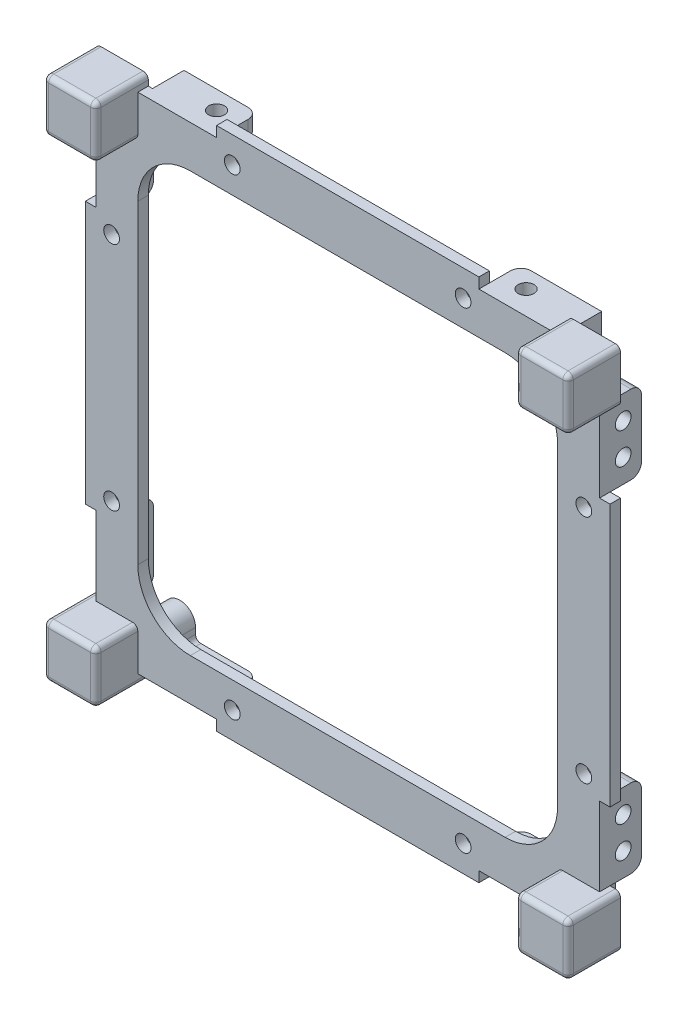
from build123d import *

# Parameters (mm, degrees)
SKETCH1_R               = 1.5
BOSS_EXTRUDE1_DEPTH     = 2
BOSS_EXTRUDE3_DEPTH     = 8
FILLET2_R               = 1
SKETCH6_R               = 1.5
SKETCH6_W               = 3
SKETCH6_H               = 15
BOSS_EXTRUDE5_DEPTH     = 6
FILLET3_R               = 2
CUT_EXTRUDE1_DEPTH      = 72.414284285
CUT_EXTRUDE1_DEPTH_BACK = 72.414284285
SKETCH7_R               = 1.5
CUT_EXTRUDE2_DEPTH      = 72.414284285
CUT_EXTRUDE2_DEPTH_BACK = 72.414284285
SKETCH8_R               = 1.5


with BuildPart() as part:
    # Sketch1 → Boss-Extrude1 (new body)
    with BuildSketch(Plane.XY):
        with BuildLine():
            Line((-50, 40), (-48, 40))
            Line((-48, 40), (-48, 25))
            Line((-48, 25), (-50, 25))
            Line((-50, 25), (-50, -25))
            Line((-50, -25), (-48, -25))
            Line((-48, -25), (-48, -40))
            Line((-48, -40), (-50, -40))
            Line((-50, -40), (-50, -49))
            ThreePointArc((-50, -49), (-49.707106781, -49.707106781), (-49, -50))
            Line((-49, -50), (-40, -50))
            Line((-40, -50), (-40, -48))
            Line((-40, -48), (-25, -48))
            Line((-25, -48), (-25, -50))
            Line((-25, -50), (25, -50))
            Line((25, -50), (25, -48))
            Line((25, -48), (40, -48))
            Line((40, -48), (40, -50))
            Line((40, -50), (49, -50))
            ThreePointArc((49, -50), (49.707106781, -49.707106781), (50, -49))
            Line((50, -49), (50, -40))
            Line((50, -40), (48, -40))
            Line((48, -40), (48, -25))
            Line((48, -25), (50, -25))
            Line((50, -25), (50, 25))
            Line((50, 25), (48, 25))
            Line((48, 25), (48, 40))
            Line((48, 40), (50, 40))
            Line((50, 40), (50, 49))
            ThreePointArc((50, 49), (49.707106781, 49.707106781), (49, 50))
            Line((49, 50), (40, 50))
            Line((40, 50), (40, 48))
            Line((40, 48), (25, 48))
            Line((25, 48), (25, 50))
            Line((25, 50), (-25, 50))
            Line((-25, 50), (-25, 48))
            Line((-25, 48), (-40, 48))
            Line((-40, 48), (-40, 50))
            Line((-40, 50), (-49, 50))
            ThreePointArc((-49, 50), (-49.707106781, 49.707106781), (-50, 49))
            Line((-50, 49), (-50, 40))
        make_face()
        with Locations((-45, 22)):
            Circle(SKETCH1_R, mode=Mode.SUBTRACT)
        with Locations((-22, 45)):
            Circle(SKETCH1_R, mode=Mode.SUBTRACT)
        with Locations((22, 45)):
            Circle(SKETCH1_R, mode=Mode.SUBTRACT)
        with Locations((45, 22)):
            Circle(SKETCH1_R, mode=Mode.SUBTRACT)
        with Locations((45, -22)):
            Circle(SKETCH1_R, mode=Mode.SUBTRACT)
        with Locations((22, -45)):
            Circle(SKETCH1_R, mode=Mode.SUBTRACT)
        with Locations((-22, -45)):
            Circle(SKETCH1_R, mode=Mode.SUBTRACT)
        with Locations((-45, -22)):
            Circle(SKETCH1_R, mode=Mode.SUBTRACT)
        with BuildLine():
            Line((-30, -40), (30, -40))
            ThreePointArc((30, -40), (37.071067812, -37.071067812), (40, -30))
            Line((40, -30), (40, 30))
            ThreePointArc((40, 30), (37.071067812, 37.071067812), (30, 40))
            Line((30, 40), (-30, 40))
            ThreePointArc((-30, 40), (-37.071067812, 37.071067812), (-40, 30))
            Line((-40, 30), (-40, -30))
            ThreePointArc((-40, -30), (-37.071067812, -37.071067812), (-30, -40))
        make_face(mode=Mode.SUBTRACT)
    extrude(amount=BOSS_EXTRUDE1_DEPTH)

    # Sketch2 → Boss-Extrude3 (add)
    with BuildSketch(Plane.XY.offset(2)):
        with BuildLine():
            Line((-49, 50), (-40, 50))
            Line((-40, 50), (-40, 40))
            Line((-40, 40), (-50, 40))
            Line((-50, 40), (-50, 49))
            ThreePointArc((-50, 49), (-49.707106781, 49.707106781), (-49, 50))
        make_face()
        with BuildLine():
            Line((40, 50), (40, 40))
            Line((40, 40), (50, 40))
            Line((50, 40), (50, 49))
            ThreePointArc((50, 49), (49.707106781, 49.707106781), (49, 50))
            Line((49, 50), (40, 50))
        make_face()
        with BuildLine():
            Line((49, -50), (40, -50))
            Line((40, -50), (40, -40))
            Line((40, -40), (50, -40))
            Line((50, -40), (50, -49))
            ThreePointArc((50, -49), (49.707106781, -49.707106781), (49, -50))
        make_face()
        with BuildLine():
            Line((-40, -50), (-40, -40))
            Line((-40, -40), (-50, -40))
            Line((-50, -40), (-50, -49))
            ThreePointArc((-50, -49), (-49.707106781, -49.707106781), (-49, -50))
            Line((-49, -50), (-40, -50))
        make_face()
    extrude(amount=BOSS_EXTRUDE3_DEPTH)

    # Fillet2
    fillet2_edges = [part.edges().sort_by_distance(p)[0] for p in [
        (-44.5, 50, 10),
        (-49.707106781, 49.707106781, 10),
        (-50, 44.5, 10),
        (-40, 50, 5),
        (-45, 40, 10),
        (-40, 45, 10),
        (-40, 40, 6),
        (-50, 40, 5),
        (-40, -50, 5),
        (-40, -45, 10),
        (-44.5, -50, 10),
        (-49.707106781, -49.707106781, 10),
        (-50, -44.5, 10),
        (-45, -40, 10),
        (-50, -40, 5),
        (-40, -40, 6),
        (50, -40, 5),
        (40, -50, 5),
        (40, -40, 6),
        (45, -40, 10),
        (50, -44.5, 10),
        (49.707106781, -49.707106781, 10),
        (44.5, -50, 10),
        (40, -45, 10),
        (40, 50, 5),
        (50, 40, 5),
        (40, 40, 6),
        (40, 45, 10),
        (49.707106781, 49.707106781, 10),
        (44.5, 50, 10),
        (50, 44.5, 10),
        (45, 40, 10),
    ]]
    fillet(fillet2_edges, radius=FILLET2_R)

    # Sketch6 → Boss-Extrude5 (add)
    # profile 1 of 8: a face of its own
    with BuildSketch(Plane(origin=(0, 0, 0), x_dir=(-1, 0, 0), z_dir=(0, 0, -1))):
        with BuildLine():
            Line((-40.4, 48), (-40.4, 42.85))
            ThreePointArc((-40.4, 42.85), (-37.4, 39.85), (-34.4, 42.85))
            Line((-34.4, 42.85), (-34.4, 44))
            ThreePointArc((-34.4, 44), (-34.107106781, 44.707106781), (-33.4, 45))
            Line((-33.4, 45), (-25, 45))
            Line((-25, 45), (-25, 48))
            Line((-25, 48), (-40.4, 48))
        make_face()
        with Locations((-37.4, 42.85)):
            Circle(SKETCH6_R, mode=Mode.SUBTRACT)
    # profile 2 of 8: a face of its own
    with BuildSketch(Plane(origin=(0, 0, 0), x_dir=(-1, 0, 0), z_dir=(0, 0, -1))):
        with BuildLine():
            Line((25, 48), (25, 45))
            Line((25, 45), (32.2, 45))
            ThreePointArc((32.2, 45), (32.907106781, 44.707106781), (33.2, 44))
            Line((33.2, 44), (33.2, 42.85))
            ThreePointArc((33.2, 42.85), (36.2, 39.85), (39.2, 42.85))
            Line((39.2, 42.85), (39.2, 48))
            Line((39.2, 48), (25, 48))
        make_face()
        with Locations((36.2, 42.85)):
            Circle(SKETCH6_R, mode=Mode.SUBTRACT)
    # profile 3 of 8: a face of its own
    with BuildSketch(Plane(origin=(0, 0, 0), x_dir=(-1, 0, 0), z_dir=(0, 0, -1))):
        with BuildLine():
            Line((-43, -48), (-43, -42.85))
            ThreePointArc((-43, -42.85), (-40, -39.85), (-37, -42.85))
            Line((-37, -42.85), (-37, -44))
            ThreePointArc((-37, -44), (-36.707106781, -44.707106781), (-36, -45))
            Line((-36, -45), (-25, -45))
            Line((-25, -45), (-25, -48))
            Line((-25, -48), (-43, -48))
        make_face()
        with Locations((-40, -42.85)):
            Circle(SKETCH6_R, mode=Mode.SUBTRACT)
    # profile 4 of 8: a face of its own
    with BuildSketch(Plane(origin=(0, 0, 0), x_dir=(-1, 0, 0), z_dir=(0, 0, -1))):
        with BuildLine():
            Line((25, -48), (25, -45))
            Line((25, -45), (36, -45))
            ThreePointArc((36, -45), (36.707106781, -44.707106781), (37, -44))
            Line((37, -44), (37, -42.85))
            ThreePointArc((37, -42.85), (40, -39.85), (43, -42.85))
            Line((43, -42.85), (43, -48))
            Line((43, -48), (25, -48))
        make_face()
        with Locations((40, -42.85)):
            Circle(SKETCH6_R, mode=Mode.SUBTRACT)
    # profile 5 of 8: a face of its own
    with BuildSketch(Plane(origin=(0, 0, 0), x_dir=(-1, 0, 0), z_dir=(0, 0, -1))):
        with Locations((-46.5, 32.5)):
            Rectangle(SKETCH6_W, SKETCH6_H)
    # profile 6 of 8: a face of its own
    with BuildSketch(Plane(origin=(0, 0, 0), x_dir=(-1, 0, 0), z_dir=(0, 0, -1))):
        with Locations((46.5, 32.5)):
            Rectangle(SKETCH6_W, SKETCH6_H)
    # profile 7 of 8: a face of its own
    with BuildSketch(Plane(origin=(0, 0, 0), x_dir=(-1, 0, 0), z_dir=(0, 0, -1))):
        with Locations((-46.5, -32.5)):
            Rectangle(SKETCH6_W, SKETCH6_H)
    # profile 8 of 8: a face of its own
    with BuildSketch(Plane(origin=(0, 0, 0), x_dir=(-1, 0, 0), z_dir=(0, 0, -1))):
        with Locations((46.5, -32.5)):
            Rectangle(SKETCH6_W, SKETCH6_H)
    extrude(amount=BOSS_EXTRUDE5_DEPTH)

    # Fillet3
    fillet3_edges = [part.edges().sort_by_distance(p)[0] for p in [
        (46.5, -40, -6),
        (46.5, -25, -6),
        (-46.5, -40, -6),
        (-46.5, -25, -6),
        (-46.5, 25, -6),
        (-46.5, 40, -6),
        (-25, 46.5, -6),
        (25, 46.5, -6),
        (46.5, 25, -6),
        (46.5, 40, -6),
        (-25, -46.5, -6),
        (25, -46.5, -6),
    ]]
    fillet(fillet3_edges, radius=FILLET3_R)

    # Sketch7 → Cut-Extrude1 (cut, two sides: drawn at the far end of the back side and taken through both)
    with BuildSketch(Plane(origin=(0, 0, 0), x_dir=(0, 0, -1), z_dir=(1, 0, 0)).offset(-CUT_EXTRUDE1_DEPTH_BACK)):
        with Locations((2.5, 35.5)):
            Circle(SKETCH7_R)
        with Locations((2.5, 29.5)):
            Circle(SKETCH7_R)
        with Locations((2.5, -29.5)):
            Circle(SKETCH7_R)
        with Locations((2.5, -35.5)):
            Circle(SKETCH7_R)
    extrude(amount=CUT_EXTRUDE1_DEPTH + CUT_EXTRUDE1_DEPTH_BACK, mode=Mode.SUBTRACT)

    # Sketch8 → Cut-Extrude2 (cut, two sides: drawn at the far end of the back side and taken through both)
    with BuildSketch(Plane(origin=(0, 0, 0), x_dir=(1, 0, 0), z_dir=(0, 1, 0)).offset(-CUT_EXTRUDE2_DEPTH_BACK)):
        with Locations((-29.5, 2.5)):
            Circle(SKETCH8_R)
        with Locations((29.5, 2.5)):
            Circle(SKETCH8_R)
    extrude(amount=CUT_EXTRUDE2_DEPTH + CUT_EXTRUDE2_DEPTH_BACK, mode=Mode.SUBTRACT)


solid = part.part
